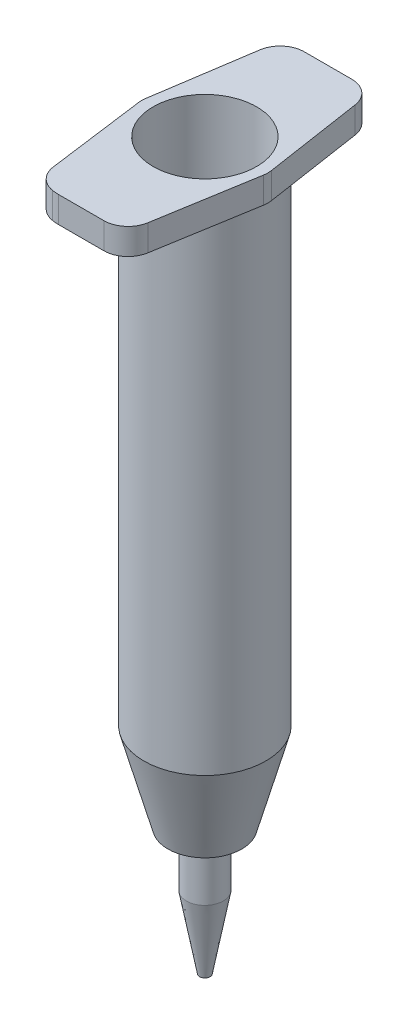
from build123d import *

# Parameters (mm, degrees)
SKETCH1_R           = 7.6
BOSS_EXTRUDE1_DEPTH = 71.3
CHAMFER1_SIZE       = 3
CHAMFER1_SIZE2      = 11
SKETCH2_R           = 2.3
BOSS_EXTRUDE2_DEPTH = 15.75
CHAMFER2_SIZE       = 9
CHAMFER2_SIZE2      = 1.65
SKETCH3_W           = 15.75
SKETCH3_H           = 30.7
BOSS_EXTRUDE3_DEPTH = 3.25
FILLET1_R           = 5
SKETCH4_R           = 6.45
CUT_EXTRUDE1_DEPTH  = 63.5
CUT_EXTRUDE2_DEPTH  = 63.5
FILLET2_R           = 3


with BuildPart() as part:
    # Sketch1 → Boss-Extrude1 (new body)
    with BuildSketch(Plane(origin=(0, 0, 0), x_dir=(1, 0, 0), z_dir=(0, 1, 0))):
        with Locations(Location((0, 0, 0), (0, 0, 270))):
            Circle(SKETCH1_R)
    extrude(amount=BOSS_EXTRUDE1_DEPTH)

    # Chamfer1
    chamfer1_edges = [part.edges().sort_by_distance(p)[0] for p in [
        (0, 0, -7.6),
    ]]
    chamfer1_side = [part.faces().sort_by_distance(p)[0] for p in [
        (0, 0, 0),
    ]]
    chamfer(chamfer1_edges, length=CHAMFER1_SIZE, length2=CHAMFER1_SIZE2, reference=chamfer1_side[0])

    # Sketch2 → Boss-Extrude2 (add)
    with BuildSketch(Plane.XZ):
        with Locations(Location((0, 0, 0), (0, 0, 270))):
            Circle(SKETCH2_R)
    extrude(amount=BOSS_EXTRUDE2_DEPTH)

    # Chamfer2
    chamfer2_edges = [part.edges().sort_by_distance(p)[0] for p in [
        (0, -15.75, 2.3),
    ]]
    chamfer2_side = [part.faces().sort_by_distance(p)[0] for p in [
        (0, -7.875, 2.3),
    ]]
    chamfer(chamfer2_edges, length=CHAMFER2_SIZE, length2=CHAMFER2_SIZE2, reference=chamfer2_side[0])

    # Sketch3 → Boss-Extrude3 (add)
    with BuildSketch(Plane(origin=(0, 71.3, 0), x_dir=(1, 0, 0), z_dir=(0, 1, 0))):
        Rectangle(SKETCH3_W, SKETCH3_H)
    extrude(amount=BOSS_EXTRUDE3_DEPTH)

    # Fillet1
    fillet1_edges = [part.edges().sort_by_distance(p)[0] for p in [
        (7.875, 72.925, 15.35),
        (7.875, 72.925, -15.35),
        (-7.875, 72.925, -15.35),
        (-7.875, 72.925, 15.35),
    ]]
    fillet(fillet1_edges, radius=FILLET1_R)

    # Sketch4 → Cut-Extrude1 (cut)
    with BuildSketch(Plane(origin=(0, 74.55, 0), x_dir=(1, 0, 0), z_dir=(0, 1, 0))):
        with Locations(Location((0, 0, 0), (0, 0, 270))):
            Circle(SKETCH4_R)
    extrude(amount=-CUT_EXTRUDE1_DEPTH, mode=Mode.SUBTRACT)

    # Sketch5 → Cut-Extrude2 (cut)
    with BuildSketch(Plane(origin=(0, 74.55, 0), x_dir=(1, 0, 0), z_dir=(0, 1, 0))):
        with BuildLine():
            Line((-5.96525379, -14.280690971), (-7.875, 0))
            Line((-7.875, 0), (-7.875, -10.35))
            ThreePointArc((-7.875, -10.35), (-7.372291905, -12.535032156), (-5.96525379, -14.280690971))
        make_face()
        with BuildLine():
            Line((7.875, -10.35), (7.875, 0))
            Line((7.875, 0), (5.433607168, -14.645757135))
            ThreePointArc((5.433607168, -14.645757135), (7.222012528, -12.820522633), (7.875, -10.35))
        make_face()
        with BuildLine():
            ThreePointArc((7.875, 10.35), (7.28906276, 12.698627247), (5.668580021, 14.496795228))
            Line((5.668580021, 14.496795228), (7.875, 0))
            Line((7.875, 0), (7.875, 10.35))
        make_face()
        with BuildLine():
            Line((-7.875, 0), (-5.681416662, 14.488118596))
            ThreePointArc((-5.681416662, 14.488118596), (-7.29269642, 12.69178529), (-7.875, 10.35))
            Line((-7.875, 10.35), (-7.875, 0))
        make_face()
    extrude(amount=-CUT_EXTRUDE2_DEPTH, mode=Mode.SUBTRACT)

    # Fillet2
    fillet2_edges = [part.edges().sort_by_distance(p)[0] for p in [
        (-5.681416662, 72.925, -14.488118596),
        (-5.96525379, 72.925, 14.280690971),
        (5.433607168, 72.925, 14.645757135),
        (5.668580021, 72.925, -14.496795228),
        (7.875, 72.925, 0),
        (-7.875, 72.925, 0),
    ]]
    fillet(fillet2_edges, radius=FILLET2_R)

    # Cut-Loft1: read off the stored shape, not the designer's step
    # Cut-Loft1: loft between two sections, ruled curve by curve
    cut_loft1_from = [
        Edge.make_bspline([(6.277417846, 11.05, 1.482067877), (3.313282092, 11.05, 14.036903568), (-9.241553599, 11.05, 11.072767814), (-6.277417846, 11.05, -1.482067877), (-3.313282092, 11.05, -14.036903568), (9.241553599, 11.05, -11.072767814), (6.277417846, 11.05, 1.482067877)], [0, 0, 0, 0, 0.5, 0.5, 0.5, 1, 1, 1, 1], 3, [1, 0.333333333, 0.333333333, 1, 0.333333333, 0.333333333, 1]),
    ]
    cut_loft1_to = [
        Edge.make_bspline([(3.134021001, 1, 1.771415357), (-0.408809713, 1, 8.039457358), (-6.676851715, 1, 4.496626645), (-3.134021001, 1, -1.771415357), (0.408809713, 1, -8.039457358), (6.676851715, 1, -4.496626645), (3.134021001, 1, 1.771415357)], [0, 0, 0, 0, 0.5, 0.5, 0.5, 1, 1, 1, 1], 3, [1, 0.333333333, 0.333333333, 1, 0.333333333, 0.333333333, 1]),
    ]
    cut_loft1 = Solid(Shell([*[Face.make_surface_from_curves(cut_loft1_from[k], cut_loft1_to[k]) for k in range(1)], Face(Wire(cut_loft1_from)), Face(Wire(cut_loft1_to))]))
    add(cut_loft1, mode=Mode.SUBTRACT)

    # Cut-Loft2: read off the stored shape, not the designer's step
    # Cut-Loft2: loft between two sections, ruled curve by curve
    cut_loft2_from = [
        Edge.make_bspline([(0.160322236, -15.75, -0.19182487), (-0.223327504, -15.75, -0.512469341), (-0.543971976, -15.75, -0.128819601), (-0.160322236, -15.75, 0.19182487), (0.223327504, -15.75, 0.512469341), (0.543971976, -15.75, 0.128819601), (0.160322236, -15.75, -0.19182487)], [0, 0, 0, 0, 0.5, 0.5, 0.5, 1, 1, 1, 1], 3, [1, 0.333333333, 0.333333333, 1, 0.333333333, 0.333333333, 1]),
    ]
    cut_loft2_to = [
        Edge.make_bspline([(0.10441536, 1, -1.265700372), (-2.426985384, 1, -1.474531093), (-2.635816105, 1, 1.056869652), (-0.10441536, 1, 1.265700372), (2.426985384, 1, 1.474531093), (2.635816105, 1, -1.056869652), (0.10441536, 1, -1.265700372)], [0, 0, 0, 0, 0.5, 0.5, 0.5, 1, 1, 1, 1], 3, [1, 0.333333333, 0.333333333, 1, 0.333333333, 0.333333333, 1]),
    ]
    cut_loft2 = Solid(Shell([*[Face.make_surface_from_curves(cut_loft2_from[k], cut_loft2_to[k]) for k in range(1)], Face(Wire(cut_loft2_from)), Face(Wire(cut_loft2_to))]))
    add(cut_loft2, mode=Mode.SUBTRACT)


solid = part.part
